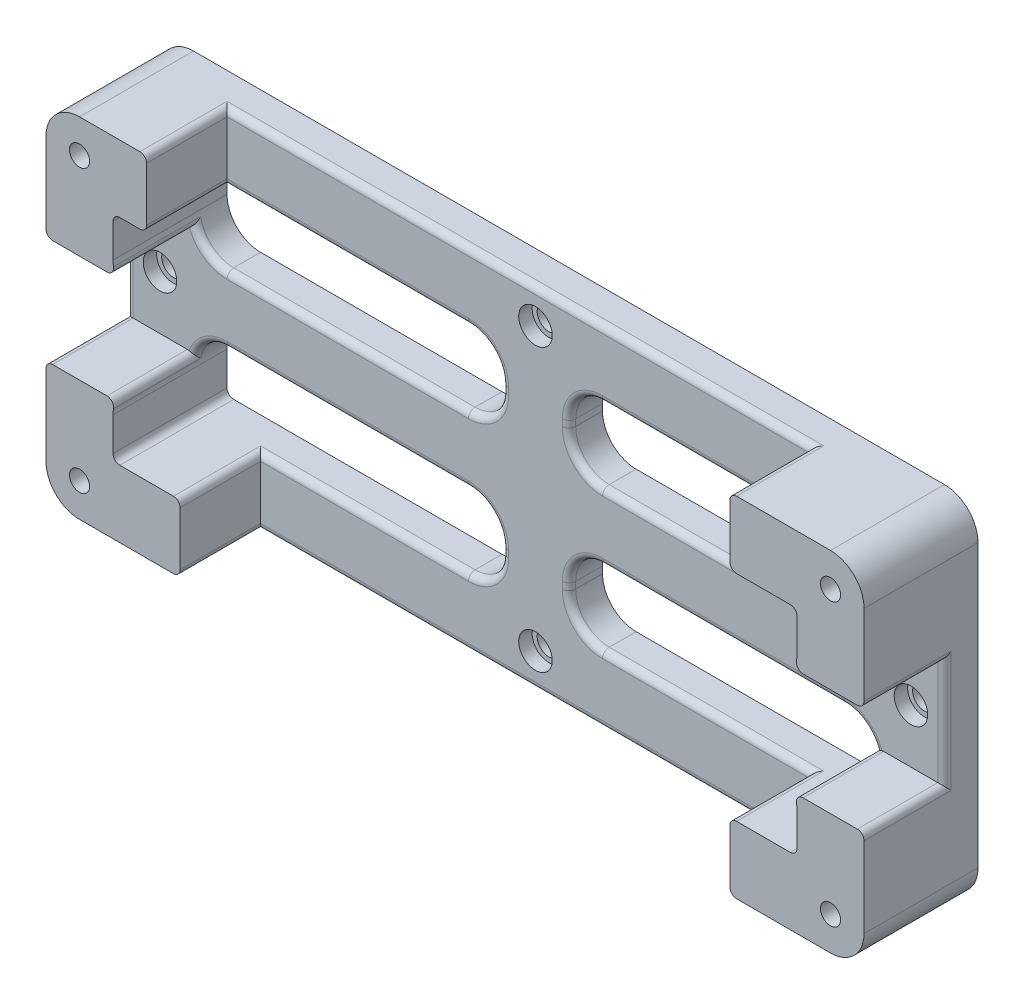
from build123d import *

# Parameters (mm, degrees)
SKETCH1_W           = 122
SKETCH1_H           = 52
SKETCH1_W_2         = 102
SKETCH1_H_2         = 32
BOSS_EXTRUDE1_DEPTH = 5
BOSS_EXTRUDE2_DEPTH = 5
BOSS_EXTRUDE3_DEPTH = 12
SKETCH4_R           = 1.5
CUT_EXTRUDE1_DEPTH  = 7
SKETCH5_R           = 1.75
CUT_EXTRUDE2_DEPTH  = 121.216471417
SKETCH6_R           = 2.5
CUT_EXTRUDE3_DEPTH  = 2
FILLET1_R           = 5
FILLET2_R           = 1


with BuildPart() as part:
    # Sketch1 → Boss-Extrude1 (new body)
    with BuildSketch(Plane.XY):
        with Locations((51, 16)):
            Rectangle(SKETCH1_W, SKETCH1_H)
        with Locations((51, 16)):
            Rectangle(SKETCH1_W_2, SKETCH1_H_2, mode=Mode.SUBTRACT)
    extrude(amount=BOSS_EXTRUDE1_DEPTH)

    # Sketch2 → Boss-Extrude2 (add)
    with BuildSketch(Plane.XY.offset(5)):
        Polygon((51, 32), (56, 32), (56, 21), (102, 21), (102, 16), (102, 11), (56, 11), (56, 0), (51, 0), (46, 0), (46, 11), (0, 11), (0, 16), (0, 21), (46, 21), (46, 32), align=None)
    extrude(amount=-BOSS_EXTRUDE2_DEPTH)

    # Sketch3 → Boss-Extrude3 (add)
    with BuildSketch(Plane.XY.offset(5)):
        Polygon((-10, 42), (5, 42), (5, 32), (0, 32), (0, 24), (-10, 24), align=None)
        Polygon((-10, -10), (10, -10), (10, 0), (0, 0), (0, 8), (-10, 8), align=None)
        Polygon((112, -10), (112, 8), (102, 8), (102, 0), (92, 0), (92, -10), align=None)
        Polygon((112, 42), (92, 42), (92, 32), (102, 32), (102, 24), (112, 24), align=None)
    extrude(amount=BOSS_EXTRUDE3_DEPTH)

    # Sketch4 → Cut-Extrude1 (cut)
    with BuildSketch(Plane.XY.offset(17)):
        with Locations((-5, 37)):
            Circle(SKETCH4_R)
        with Locations((107, 37)):
            Circle(SKETCH4_R)
        with Locations((107, -5)):
            Circle(SKETCH4_R)
        with Locations((-5, -5)):
            Circle(SKETCH4_R)
    extrude(amount=-CUT_EXTRUDE1_DEPTH, mode=Mode.SUBTRACT)

    # Sketch5 → Cut-Extrude2 (cut, through all)
    with BuildSketch(Plane.XY.offset(5)):
        with Locations((-5, 16)):
            Circle(SKETCH5_R)
        with Locations((51, 37)):
            Circle(SKETCH5_R)
        with Locations((107, 16)):
            Circle(SKETCH5_R)
        with Locations((51, -5)):
            Circle(SKETCH5_R)
    extrude(amount=-CUT_EXTRUDE2_DEPTH, mode=Mode.SUBTRACT)

    # Sketch6 → Cut-Extrude3 (cut)
    with BuildSketch(Plane.XY.offset(5)):
        with Locations((-5, 16)):
            Circle(SKETCH6_R)
        with Locations((51, 37)):
            Circle(SKETCH6_R)
        with Locations((51, -5)):
            Circle(SKETCH6_R)
        with Locations((107, 16)):
            Circle(SKETCH6_R)
    extrude(amount=-CUT_EXTRUDE3_DEPTH, mode=Mode.SUBTRACT)

    # Fillet1
    fillet1_edges = [part.edges().sort_by_distance(p)[0] for p in [
        (-10, 42, 8.5),
        (112, 42, 8.5),
        (112, -10, 8.5),
        (-10, -10, 8.5),
        (56, 11, 2.5),
        (56, 0, 2.5),
        (56, 21, 2.5),
        (102, 21, 2.5),
        (56, 32, 2.5),
        (102, 11, 2.5),
        (46, 0, 2.5),
        (46, 11, 2.5),
        (0, 11, 2.5),
        (0, 21, 2.5),
        (46, 32, 2.5),
        (46, 21, 2.5),
    ]]
    fillet(fillet1_edges, radius=FILLET1_R)

    # Fillet2
    # the kernel refuses this fillet: 1 mm, written as the material it adds along each edge
    with BuildSketch(Plane(origin=(0, 32, 0), x_dir=(0, -1, 0), z_dir=(0, 0, 1)), Plane(origin=(102, 0, 0), x_dir=(0, 1, 0), z_dir=(0, 0, 1)), Plane(origin=(102, 32, 0), x_dir=(-1, 0, 0), z_dir=(0, 0, 1))) as fillet2_piece_1:
        with BuildLine():
            CenterArc((FILLET2_R, FILLET2_R), FILLET2_R, 180, 90)
            Line((0, FILLET2_R), (0, 0))
            Line((0, 0), (FILLET2_R, 0))
        make_face()
    extrude(amount=17)
    with BuildSketch(Plane(origin=(0, 0, 17), x_dir=(1, 0, 0), z_dir=(0, 0, -1))) as fillet2_piece_2:
        with BuildLine():
            CenterArc((FILLET2_R, -FILLET2_R), FILLET2_R, 90, 90)
            Line((0, -FILLET2_R), (0, 0))
            Line((0, 0), (FILLET2_R, 0))
        make_face()
    extrude(amount=17)
    # the kernel refuses this fillet: 1 mm, written as the material it takes off along each edge
    with BuildSketch(Plane(origin=(112, 8, 5), x_dir=(-1, 0, 0), z_dir=(0, 1, 0)), Plane(origin=(-10, 24, 5), x_dir=(1, 0, 0), z_dir=(0, -1, 0))) as fillet2_2_piece_1:
        with BuildLine():
            CenterArc((FILLET2_R, -FILLET2_R), FILLET2_R, 90, 90)
            Line((0, -FILLET2_R), (0, 0))
            Line((0, 0), (FILLET2_R, 0))
        make_face()
    extrude(amount=16, mode=Mode.SUBTRACT)
    with BuildSketch(Plane(origin=(92, -10, 5), x_dir=(1, 0, 0), z_dir=(0, 0, 1)), Plane(origin=(92, 0, 5), x_dir=(0, -1, 0), z_dir=(0, 0, 1)), Plane(origin=(112, 24, 5), x_dir=(0, 1, 0), z_dir=(0, 0, 1)), Plane(origin=(92, 32, 5), x_dir=(1, 0, 0), z_dir=(0, 0, 1)), Plane(origin=(5, 42, 5), x_dir=(-1, 0, 0), z_dir=(0, 0, 1)), Plane(origin=(-10, 8, 5), x_dir=(0, -1, 0), z_dir=(0, 0, 1))) as fillet2_2_piece_2:
        with BuildLine():
            CenterArc((FILLET2_R, FILLET2_R), FILLET2_R, 180, 90)
            Line((0, FILLET2_R), (0, 0))
            Line((0, 0), (FILLET2_R, 0))
        make_face()
    extrude(amount=14.5, mode=Mode.SUBTRACT)
    with BuildSketch(Plane(origin=(112, 8, 5), x_dir=(0, -1, 0), z_dir=(0, 0, 1)), Plane(origin=(92, 42, 5), x_dir=(1, 0, 0), z_dir=(0, 0, 1)), Plane(origin=(-10, 24, 5), x_dir=(0, 1, 0), z_dir=(0, 0, 1)), Plane(origin=(5, 32, 5), x_dir=(-1, 0, 0), z_dir=(0, 0, 1)), Plane(origin=(10, -10, 5), x_dir=(-1, 0, 0), z_dir=(0, 0, 1)), Plane(origin=(10, 0, 5), x_dir=(0, -1, 0), z_dir=(0, 0, 1))) as fillet2_2_piece_3:
        with BuildLine():
            CenterArc((FILLET2_R, -FILLET2_R), FILLET2_R, 90, 90)
            Line((0, -FILLET2_R), (0, 0))
            Line((0, 0), (FILLET2_R, 0))
        make_face()
    extrude(amount=14.5, mode=Mode.SUBTRACT)
    with BuildSketch(Plane(origin=(92, 42, 5), x_dir=(0, -1, 0), z_dir=(-1, 0, 0))) as fillet2_2_piece_4:
        with BuildLine():
            CenterArc((FILLET2_R, -FILLET2_R), FILLET2_R, 90, 90)
            Line((0, -FILLET2_R), (0, 0))
            Line((0, 0), (FILLET2_R, 0))
        make_face()
    extrude(amount=87, mode=Mode.SUBTRACT)
    with BuildSketch(Plane(origin=(92, 32, 5), x_dir=(0, 1, 0), z_dir=(-1, 0, 0)), Plane(origin=(61, 0, 5), x_dir=(0, -1, 0), z_dir=(1, 0, 0)), Plane(origin=(10, 0, 5), x_dir=(0, -1, 0), z_dir=(1, 0, 0))) as fillet2_2_piece_5:
        with BuildLine():
            CenterArc((FILLET2_R, FILLET2_R), FILLET2_R, 180, 90)
            Line((0, FILLET2_R), (0, 0))
            Line((0, 0), (FILLET2_R, 0))
        make_face()
    extrude(amount=31, mode=Mode.SUBTRACT)
    with BuildSketch(Plane(origin=(56, 6, 5), x_dir=(-1, 0, 0), z_dir=(0, -1, 0)), Plane(origin=(56, 27, 5), x_dir=(-1, 0, 0), z_dir=(0, -1, 0)), Plane(origin=(46, 5, 5), x_dir=(1, 0, 0), z_dir=(0, 1, 0)), Plane(origin=(46, 26, 5), x_dir=(1, 0, 0), z_dir=(0, 1, 0))) as fillet2_2_piece_6:
        with BuildLine():
            CenterArc((FILLET2_R, FILLET2_R), FILLET2_R, 180, 90)
            Line((0, FILLET2_R), (0, 0))
            Line((0, 0), (FILLET2_R, 0))
        make_face()
    extrude(amount=1, mode=Mode.SUBTRACT)
    with BuildSketch(Plane(origin=(97, 11, 5), x_dir=(0, 1, 0), z_dir=(-1, 0, 0)), Plane(origin=(61, 21, 5), x_dir=(0, -1, 0), z_dir=(1, 0, 0)), Plane(origin=(41, 11, 5), x_dir=(0, 1, 0), z_dir=(-1, 0, 0)), Plane(origin=(5, 21, 5), x_dir=(0, -1, 0), z_dir=(1, 0, 0)), Plane(origin=(41, 32, 5), x_dir=(0, 1, 0), z_dir=(-1, 0, 0))) as fillet2_2_piece_7:
        with BuildLine():
            CenterArc((FILLET2_R, FILLET2_R), FILLET2_R, 180, 90)
            Line((0, FILLET2_R), (0, 0))
            Line((0, 0), (FILLET2_R, 0))
        make_face()
    extrude(amount=36, mode=Mode.SUBTRACT)
    with BuildSketch(Plane(origin=(61, 6, 5), x_dir=(-1, 0, 0), z_dir=(0, -1, 0))) as fillet2_2_piece_8:
        with BuildLine():
            CenterArc((5 + FILLET2_R, FILLET2_R), FILLET2_R, 180, 90)
            Line((5, FILLET2_R), (5, 0))
            Line((5, 0), (5 + FILLET2_R, 0))
        make_face()
    revolve(axis=Axis((61, 6, 5), (0, 0, -1)), revolution_arc=90, mode=Mode.SUBTRACT)
    with BuildSketch(Plane(origin=(61, 5, 5), x_dir=(0, -1, 0), z_dir=(1, 0, 0))) as fillet2_2_piece_9:
        with BuildLine():
            CenterArc((5 + FILLET2_R, FILLET2_R), FILLET2_R, 180, 90)
            Line((5, FILLET2_R), (5, 0))
            Line((5, 0), (5 + FILLET2_R, 0))
        make_face()
    revolve(axis=Axis((61, 5, 5), (0, 0, -1)), revolution_arc=90, mode=Mode.SUBTRACT)
    with BuildSketch(Plane(origin=(61, 26, 5), x_dir=(0, -1, 0), z_dir=(1, 0, 0))) as fillet2_2_piece_10:
        with BuildLine():
            CenterArc((5 + FILLET2_R, FILLET2_R), FILLET2_R, 180, 90)
            Line((5, FILLET2_R), (5, 0))
            Line((5, 0), (5 + FILLET2_R, 0))
        make_face()
    revolve(axis=Axis((61, 26, 5), (0, 0, -1)), revolution_arc=90, mode=Mode.SUBTRACT)
    with BuildSketch(Plane(origin=(101.582575695, 24, 20.33376022), x_dir=(0.28545625982941963, 0.9583917381343596, 0), z_dir=(0, 0, -1)), Plane(origin=(101.582575695, 8, 5), x_dir=(0.2854562598294208, -0.9583917381343592, 0), z_dir=(0, 0, 1))) as fillet2_2_piece_11:
        with BuildLine():
            CenterArc((1.339048828, 0.992563041), FILLET2_R, 163.413876647, 99.594068227)
            Line((0.380657089, 1.278019301), (0, 0))
            ThreePointArc((0, 0), (0.608658558, 0.037184795), (1.217317116, 0))
        make_face()
    extrude(amount=15.33376022, mode=Mode.SUBTRACT)
    with BuildSketch(Plane(origin=(97, 26, 5), x_dir=(0.9960782469793129, 0.08847669690160782, 0), z_dir=(-0.08847669690160782, 0.9960782469793129, 0))) as fillet2_2_piece_12_section:
        with BuildLine():
            CenterArc((5 + FILLET2_R, FILLET2_R), FILLET2_R, 180, 90)
            Line((5, FILLET2_R), (5, 0))
            Line((5, 0), (5 + FILLET2_R, 0))
        make_face()
    fillet2_2_piece_12 = revolve(axis=Axis((97, 26, 5), (0, 0, -1)), revolution_arc=95.075978632, mode=Mode.PRIVATE)
    fillet2_2_piece_12 = split(fillet2_2_piece_12, bisect_by=Plane(origin=(100.051108418, 24, 4.715325201), z_dir=(0, -1, 0)), keep=Keep.TOP, mode=Mode.PRIVATE)
    add(fillet2_2_piece_12, mode=Mode.SUBTRACT)
    with BuildSketch(Plane(origin=(61, 27, 5), x_dir=(-1, 0, 0), z_dir=(0, -1, 0))) as fillet2_2_piece_13:
        with BuildLine():
            CenterArc((5 + FILLET2_R, FILLET2_R), FILLET2_R, 180, 90)
            Line((5, FILLET2_R), (5, 0))
            Line((5, 0), (5 + FILLET2_R, 0))
        make_face()
    revolve(axis=Axis((61, 27, 5), (0, 0, -1)), revolution_arc=90, mode=Mode.SUBTRACT)
    with BuildSketch(Plane(origin=(97, 6, 5), x_dir=(0, 1, 0), z_dir=(-1, 0, 0))) as fillet2_2_piece_14_section:
        with BuildLine():
            CenterArc((5 + FILLET2_R, FILLET2_R), FILLET2_R, 180, 90)
            Line((5, FILLET2_R), (5, 0))
            Line((5, 0), (5 + FILLET2_R, 0))
        make_face()
    fillet2_2_piece_14 = revolve(axis=Axis((97, 6, 5), (0, 0, -1)), revolution_arc=95.075978632, mode=Mode.PRIVATE)
    fillet2_2_piece_14 = split(fillet2_2_piece_14, bisect_by=Plane(origin=(100.051108415, 8, 4.715325206), z_dir=(0, 1, 0)), keep=Keep.TOP, mode=Mode.PRIVATE)
    add(fillet2_2_piece_14, mode=Mode.SUBTRACT)
    with BuildSketch(Plane(origin=(41, 5, 5), x_dir=(0, -1, 0), z_dir=(-1, 0, 0))) as fillet2_2_piece_15:
        with BuildLine():
            CenterArc((5 + FILLET2_R, -FILLET2_R), FILLET2_R, 90, 90)
            Line((5, -FILLET2_R), (5, 0))
            Line((5, 0), (5 + FILLET2_R, 0))
        make_face()
    revolve(axis=Axis((41, 5, 5), (0, 0, 1)), revolution_arc=90, mode=Mode.SUBTRACT)
    with BuildSketch(Plane(origin=(41, 6, 5), x_dir=(1, 0, 0), z_dir=(0, -1, 0))) as fillet2_2_piece_16:
        with BuildLine():
            CenterArc((5 + FILLET2_R, -FILLET2_R), FILLET2_R, 90, 90)
            Line((5, -FILLET2_R), (5, 0))
            Line((5, 0), (5 + FILLET2_R, 0))
        make_face()
    revolve(axis=Axis((41, 6, 5), (0, 0, 1)), revolution_arc=90, mode=Mode.SUBTRACT)
    with BuildSketch(Plane(origin=(0.417424305, 8, 20.33376022), x_dir=(-1, 0, 0), z_dir=(0, 0, -1))) as fillet2_2_piece_17:
        with BuildLine():
            CenterArc((1.333504088, -1), FILLET2_R, 90, 99.594068227)
            ThreePointArc((0.347490791, -1.166666667), (0.209382996, -0.572718701), (0, 0))
            Line((0, 0), (1.333504088, 0))
        make_face()
    extrude(amount=15.33376022, mode=Mode.SUBTRACT)
    with BuildSketch(Plane(origin=(5, 6, 5), x_dir=(-0.9960782469793135, -0.08847669690160202, 0), z_dir=(0.08847669690160202, -0.9960782469793135, 0))) as fillet2_2_piece_18_section:
        with BuildLine():
            CenterArc((5 + FILLET2_R, FILLET2_R), FILLET2_R, 180, 90)
            Line((5, FILLET2_R), (5, 0))
            Line((5, 0), (5 + FILLET2_R, 0))
        make_face()
    fillet2_2_piece_18 = revolve(axis=Axis((5, 6, 5), (0, 0, -1)), revolution_arc=95.075978632, mode=Mode.PRIVATE)
    fillet2_2_piece_18 = split(fillet2_2_piece_18, bisect_by=Plane(origin=(1.948891582, 8, 4.715325201), z_dir=(0, 1, 0)), keep=Keep.TOP, mode=Mode.PRIVATE)
    add(fillet2_2_piece_18, mode=Mode.SUBTRACT)
    with BuildSketch(Plane(origin=(5, 26, 5), x_dir=(-0.9960782469793129, 0.08847669690160771, 0), z_dir=(0.08847669690160771, 0.9960782469793129, 0))) as fillet2_2_piece_19_section:
        with BuildLine():
            CenterArc((5 + FILLET2_R, -FILLET2_R), FILLET2_R, 90, 90)
            Line((5, -FILLET2_R), (5, 0))
            Line((5, 0), (5 + FILLET2_R, 0))
        make_face()
    fillet2_2_piece_19 = revolve(axis=Axis((5, 26, 5), (0, 0, 1)), revolution_arc=95.075978632, mode=Mode.PRIVATE)
    fillet2_2_piece_19 = split(fillet2_2_piece_19, bisect_by=Plane(origin=(1.948891582, 24, 4.715325201), z_dir=(0, -1, 0)), keep=Keep.TOP, mode=Mode.PRIVATE)
    add(fillet2_2_piece_19, mode=Mode.SUBTRACT)
    with BuildSketch(Plane(origin=(0.417424305, 24, 20.33376022), x_dir=(-0.28545625982941775, 0.9583917381343602, 0), z_dir=(0, 0, -1))) as fillet2_2_piece_20:
        with BuildLine():
            CenterArc((1.339048828, -0.992563041), FILLET2_R, 96.992055126, 99.594068227)
            Line((0.380657089, -1.278019301), (0, 0))
            ThreePointArc((0, 0), (0.608658558, -0.037184795), (1.217317116, 0))
        make_face()
    extrude(amount=15.33376022, mode=Mode.SUBTRACT)
    with BuildSketch(Plane(origin=(41, 27, 5), x_dir=(1, 0, 0), z_dir=(0, -1, 0))) as fillet2_2_piece_21:
        with BuildLine():
            CenterArc((5 + FILLET2_R, -FILLET2_R), FILLET2_R, 90, 90)
            Line((5, -FILLET2_R), (5, 0))
            Line((5, 0), (5 + FILLET2_R, 0))
        make_face()
    revolve(axis=Axis((41, 27, 5), (0, 0, 1)), revolution_arc=90, mode=Mode.SUBTRACT)
    with BuildSketch(Plane(origin=(41, 26, 5), x_dir=(0, -1, 0), z_dir=(-1, 0, 0))) as fillet2_2_piece_22:
        with BuildLine():
            CenterArc((5 + FILLET2_R, -FILLET2_R), FILLET2_R, 90, 90)
            Line((5, -FILLET2_R), (5, 0))
            Line((5, 0), (5 + FILLET2_R, 0))
        make_face()
    revolve(axis=Axis((41, 26, 5), (0, 0, 1)), revolution_arc=90, mode=Mode.SUBTRACT)
    with BuildSketch(Plane(origin=(10, -10, 5), x_dir=(0, 0, -1), z_dir=(1, 0, 0))) as fillet2_2_piece_23:
        with BuildLine():
            CenterArc((FILLET2_R, FILLET2_R), FILLET2_R, 180, 90)
            Line((0, FILLET2_R), (0, 0))
            Line((0, 0), (FILLET2_R, 0))
        make_face()
    extrude(amount=82, mode=Mode.SUBTRACT)
    with BuildSketch(Plane(origin=(112, 5.5, 5), x_dir=(-1, 0, 0), z_dir=(0, 1, 0))) as fillet2_2_piece_24a_section:
        with BuildLine():
            CenterArc((FILLET2_R, -FILLET2_R), FILLET2_R, 90, 90)
            Line((0, -FILLET2_R), (0, 0))
            Line((0, 0), (FILLET2_R, 0))
        make_face()
    fillet2_2_piece_24a = extrude(amount=18.5, mode=Mode.PRIVATE)
    fillet2_2_piece_24a = split(fillet2_2_piece_24a, bisect_by=Plane(origin=(111.773604886, 8, 4.773604886), z_dir=(0, -1, 0)), keep=Keep.TOP, mode=Mode.PRIVATE)
    with BuildSketch(Plane(origin=(112, 8, 2.5), x_dir=(0, -1, 0), z_dir=(0, 0, 1))) as fillet2_2_piece_24b_section:
        with BuildLine():
            CenterArc((FILLET2_R, -FILLET2_R), FILLET2_R, 90, 90)
            Line((0, -FILLET2_R), (0, 0))
            Line((0, 0), (FILLET2_R, 0))
        make_face()
    fillet2_2_piece_24b = extrude(amount=17, mode=Mode.PRIVATE)
    fillet2_2_piece_24b = split(fillet2_2_piece_24b, bisect_by=Plane(origin=(111.773604886, 7.773604886, 5), z_dir=(0, 0, -1)), keep=Keep.TOP, mode=Mode.PRIVATE)
    fillet2_2_piece_24 = fillet2_2_piece_24a & fillet2_2_piece_24b
    add(fillet2_2_piece_24, mode=Mode.SUBTRACT)
    with BuildSketch(Plane(origin=(112, 8, 5), x_dir=(-1, 0, 0), z_dir=(0, 1, 0))) as fillet2_2_piece_25a_section:
        with BuildLine():
            CenterArc((FILLET2_R, -FILLET2_R), FILLET2_R, 90, 90)
            Line((0, -FILLET2_R), (0, 0))
            Line((0, 0), (FILLET2_R, 0))
        make_face()
    fillet2_2_piece_25a = extrude(amount=18.5, mode=Mode.PRIVATE)
    fillet2_2_piece_25a = split(fillet2_2_piece_25a, bisect_by=Plane(origin=(111.773604886, 24, 4.773604886), z_dir=(0, 1, 0)), keep=Keep.TOP, mode=Mode.PRIVATE)
    with BuildSketch(Plane(origin=(112, 24, 2.5), x_dir=(0, 1, 0), z_dir=(0, 0, 1))) as fillet2_2_piece_25b_section:
        with BuildLine():
            CenterArc((FILLET2_R, FILLET2_R), FILLET2_R, 180, 90)
            Line((0, FILLET2_R), (0, 0))
            Line((0, 0), (FILLET2_R, 0))
        make_face()
    fillet2_2_piece_25b = extrude(amount=17, mode=Mode.PRIVATE)
    fillet2_2_piece_25b = split(fillet2_2_piece_25b, bisect_by=Plane(origin=(111.773604886, 24.226395114, 5), z_dir=(0, 0, -1)), keep=Keep.TOP, mode=Mode.PRIVATE)
    fillet2_2_piece_25 = fillet2_2_piece_25a & fillet2_2_piece_25b
    add(fillet2_2_piece_25, mode=Mode.SUBTRACT)
    with BuildSketch(Plane(origin=(10, -10, 5), x_dir=(0, 0, -1), z_dir=(1, 0, 0))) as fillet2_2_piece_26a_section:
        with BuildLine():
            CenterArc((FILLET2_R, FILLET2_R), FILLET2_R, 180, 90)
            Line((0, FILLET2_R), (0, 0))
            Line((0, 0), (FILLET2_R, 0))
        make_face()
    fillet2_2_piece_26a = extrude(amount=84.5, mode=Mode.PRIVATE)
    fillet2_2_piece_26a = split(fillet2_2_piece_26a, bisect_by=Plane(origin=(92, -9.773604886, 4.773604886), z_dir=(1, 0, 0)), keep=Keep.TOP, mode=Mode.PRIVATE)
    with BuildSketch(Plane(origin=(92, -10, 2.5), x_dir=(1, 0, 0), z_dir=(0, 0, 1))) as fillet2_2_piece_26b_section:
        with BuildLine():
            CenterArc((FILLET2_R, FILLET2_R), FILLET2_R, 180, 90)
            Line((0, FILLET2_R), (0, 0))
            Line((0, 0), (FILLET2_R, 0))
        make_face()
    fillet2_2_piece_26b = extrude(amount=17, mode=Mode.PRIVATE)
    fillet2_2_piece_26b = split(fillet2_2_piece_26b, bisect_by=Plane(origin=(92.226395114, -9.773604886, 5), z_dir=(0, 0, -1)), keep=Keep.TOP, mode=Mode.PRIVATE)
    fillet2_2_piece_26 = fillet2_2_piece_26a & fillet2_2_piece_26b
    add(fillet2_2_piece_26, mode=Mode.SUBTRACT)
    with BuildSketch(Plane(origin=(61, 0, 5), x_dir=(0, -1, 0), z_dir=(1, 0, 0))) as fillet2_2_piece_27a_section:
        with BuildLine():
            CenterArc((FILLET2_R, FILLET2_R), FILLET2_R, 180, 90)
            Line((0, FILLET2_R), (0, 0))
            Line((0, 0), (FILLET2_R, 0))
        make_face()
    fillet2_2_piece_27a = extrude(amount=33.5, mode=Mode.PRIVATE)
    fillet2_2_piece_27a = split(fillet2_2_piece_27a, bisect_by=Plane(origin=(92, -0.226395114, 4.773604886), z_dir=(1, 0, 0)), keep=Keep.TOP, mode=Mode.PRIVATE)
    with BuildSketch(Plane(origin=(92, 0, 2.5), x_dir=(0, -1, 0), z_dir=(0, 0, 1))) as fillet2_2_piece_27b_section:
        with BuildLine():
            CenterArc((FILLET2_R, FILLET2_R), FILLET2_R, 180, 90)
            Line((0, FILLET2_R), (0, 0))
            Line((0, 0), (FILLET2_R, 0))
        make_face()
    fillet2_2_piece_27b = extrude(amount=17, mode=Mode.PRIVATE)
    fillet2_2_piece_27b = split(fillet2_2_piece_27b, bisect_by=Plane(origin=(92.226395114, -0.226395114, 5), z_dir=(0, 0, -1)), keep=Keep.TOP, mode=Mode.PRIVATE)
    fillet2_2_piece_27 = fillet2_2_piece_27a & fillet2_2_piece_27b
    add(fillet2_2_piece_27, mode=Mode.SUBTRACT)
    with BuildSketch(Plane(origin=(94.5, 42, 5), x_dir=(0, -1, 0), z_dir=(-1, 0, 0))) as fillet2_2_piece_28a_section:
        with BuildLine():
            CenterArc((FILLET2_R, -FILLET2_R), FILLET2_R, 90, 90)
            Line((0, -FILLET2_R), (0, 0))
            Line((0, 0), (FILLET2_R, 0))
        make_face()
    fillet2_2_piece_28a = extrude(amount=89.5, mode=Mode.PRIVATE)
    fillet2_2_piece_28a = split(fillet2_2_piece_28a, bisect_by=Plane(origin=(92, 41.773604886, 4.773604886), z_dir=(1, 0, 0)), keep=Keep.TOP, mode=Mode.PRIVATE)
    with BuildSketch(Plane(origin=(92, 42, 2.5), x_dir=(1, 0, 0), z_dir=(0, 0, 1))) as fillet2_2_piece_28b_section:
        with BuildLine():
            CenterArc((FILLET2_R, -FILLET2_R), FILLET2_R, 90, 90)
            Line((0, -FILLET2_R), (0, 0))
            Line((0, 0), (FILLET2_R, 0))
        make_face()
    fillet2_2_piece_28b = extrude(amount=17, mode=Mode.PRIVATE)
    fillet2_2_piece_28b = split(fillet2_2_piece_28b, bisect_by=Plane(origin=(92.226395114, 41.773604886, 5), z_dir=(0, 0, -1)), keep=Keep.TOP, mode=Mode.PRIVATE)
    fillet2_2_piece_28 = fillet2_2_piece_28a & fillet2_2_piece_28b
    add(fillet2_2_piece_28, mode=Mode.SUBTRACT)
    with BuildSketch(Plane(origin=(92, 42, 5), x_dir=(0, -1, 0), z_dir=(-1, 0, 0))) as fillet2_2_piece_29a_section:
        with BuildLine():
            CenterArc((FILLET2_R, -FILLET2_R), FILLET2_R, 90, 90)
            Line((0, -FILLET2_R), (0, 0))
            Line((0, 0), (FILLET2_R, 0))
        make_face()
    fillet2_2_piece_29a = extrude(amount=89.5, mode=Mode.PRIVATE)
    fillet2_2_piece_29a = split(fillet2_2_piece_29a, bisect_by=Plane(origin=(5, 41.773604886, 4.773604886), z_dir=(-1, 0, 0)), keep=Keep.TOP, mode=Mode.PRIVATE)
    with BuildSketch(Plane(origin=(5, 42, 2.5), x_dir=(-1, 0, 0), z_dir=(0, 0, 1))) as fillet2_2_piece_29b_section:
        with BuildLine():
            CenterArc((FILLET2_R, FILLET2_R), FILLET2_R, 180, 90)
            Line((0, FILLET2_R), (0, 0))
            Line((0, 0), (FILLET2_R, 0))
        make_face()
    fillet2_2_piece_29b = extrude(amount=17, mode=Mode.PRIVATE)
    fillet2_2_piece_29b = split(fillet2_2_piece_29b, bisect_by=Plane(origin=(4.773604886, 41.773604886, 5), z_dir=(0, 0, -1)), keep=Keep.TOP, mode=Mode.PRIVATE)
    fillet2_2_piece_29 = fillet2_2_piece_29a & fillet2_2_piece_29b
    add(fillet2_2_piece_29, mode=Mode.SUBTRACT)
    with BuildSketch(Plane(origin=(94.5, 32, 5), x_dir=(0, 1, 0), z_dir=(-1, 0, 0))) as fillet2_2_piece_30a_section:
        with BuildLine():
            CenterArc((FILLET2_R, FILLET2_R), FILLET2_R, 180, 90)
            Line((0, FILLET2_R), (0, 0))
            Line((0, 0), (FILLET2_R, 0))
        make_face()
    fillet2_2_piece_30a = extrude(amount=33.5, mode=Mode.PRIVATE)
    fillet2_2_piece_30a = split(fillet2_2_piece_30a, bisect_by=Plane(origin=(92, 32.226395114, 4.773604886), z_dir=(1, 0, 0)), keep=Keep.TOP, mode=Mode.PRIVATE)
    with BuildSketch(Plane(origin=(92, 32, 2.5), x_dir=(1, 0, 0), z_dir=(0, 0, 1))) as fillet2_2_piece_30b_section:
        with BuildLine():
            CenterArc((FILLET2_R, FILLET2_R), FILLET2_R, 180, 90)
            Line((0, FILLET2_R), (0, 0))
            Line((0, 0), (FILLET2_R, 0))
        make_face()
    fillet2_2_piece_30b = extrude(amount=17, mode=Mode.PRIVATE)
    fillet2_2_piece_30b = split(fillet2_2_piece_30b, bisect_by=Plane(origin=(92.226395114, 32.226395114, 5), z_dir=(0, 0, -1)), keep=Keep.TOP, mode=Mode.PRIVATE)
    fillet2_2_piece_30 = fillet2_2_piece_30a & fillet2_2_piece_30b
    add(fillet2_2_piece_30, mode=Mode.SUBTRACT)
    with BuildSketch(Plane(origin=(41, 32, 5), x_dir=(0, 1, 0), z_dir=(-1, 0, 0))) as fillet2_2_piece_31a_section:
        with BuildLine():
            CenterArc((FILLET2_R, FILLET2_R), FILLET2_R, 180, 90)
            Line((0, FILLET2_R), (0, 0))
            Line((0, 0), (FILLET2_R, 0))
        make_face()
    fillet2_2_piece_31a = extrude(amount=38.5, mode=Mode.PRIVATE)
    fillet2_2_piece_31a = split(fillet2_2_piece_31a, bisect_by=Plane(origin=(5, 32.226395114, 4.773604886), z_dir=(-1, 0, 0)), keep=Keep.TOP, mode=Mode.PRIVATE)
    with BuildSketch(Plane(origin=(5, 32, 2.5), x_dir=(-1, 0, 0), z_dir=(0, 0, 1))) as fillet2_2_piece_31b_section:
        with BuildLine():
            CenterArc((FILLET2_R, -FILLET2_R), FILLET2_R, 90, 90)
            Line((0, -FILLET2_R), (0, 0))
            Line((0, 0), (FILLET2_R, 0))
        make_face()
    fillet2_2_piece_31b = extrude(amount=17, mode=Mode.PRIVATE)
    fillet2_2_piece_31b = split(fillet2_2_piece_31b, bisect_by=Plane(origin=(4.773604886, 32.226395114, 5), z_dir=(0, 0, -1)), keep=Keep.TOP, mode=Mode.PRIVATE)
    fillet2_2_piece_31 = fillet2_2_piece_31a & fillet2_2_piece_31b
    add(fillet2_2_piece_31, mode=Mode.SUBTRACT)
    with BuildSketch(Plane(origin=(97, 26, 5), x_dir=(0.9960782469793129, 0.08847669690160782, 0), z_dir=(-0.08847669690160782, 0.9960782469793129, 0))) as fillet2_2_piece_32a_section:
        with BuildLine():
            CenterArc((5 + FILLET2_R, FILLET2_R), FILLET2_R, 180, 90)
            Line((5, FILLET2_R), (5, 0))
            Line((5, 0), (5 + FILLET2_R, 0))
        make_face()
    fillet2_2_piece_32a = revolve(axis=Axis((97, 26, 5), (0, 0, -1)), revolution_arc=95.075978632, mode=Mode.PRIVATE)
    fillet2_2_piece_32a = split(fillet2_2_piece_32a, bisect_by=Plane(origin=(102.117412409, 24, 4.774344712), z_dir=(0, 1, 0)), keep=Keep.TOP, mode=Mode.PRIVATE)
    with BuildSketch(Plane(origin=(101.582575695, 24, 20.33376022), x_dir=(0.28545625982941963, 0.9583917381343596, 0), z_dir=(0, 0, -1))) as fillet2_2_piece_32b_section:
        with BuildLine():
            CenterArc((1.339048828, 0.992563041), FILLET2_R, 163.413876647, 99.594068227)
            Line((0.380657089, 1.278019301), (0, 0))
            ThreePointArc((0, 0), (0.608658558, 0.037184795), (1.217317116, 0))
        make_face()
    fillet2_2_piece_32b = extrude(amount=18.667520441, mode=Mode.PRIVATE)
    fillet2_2_piece_32b = split(fillet2_2_piece_32b, bisect_by=Plane(origin=(102.003252364, 24.270753298, 5), z_dir=(0, 0, -1)), keep=Keep.TOP, mode=Mode.PRIVATE)
    fillet2_2_piece_32 = fillet2_2_piece_32a & fillet2_2_piece_32b
    add(fillet2_2_piece_32, mode=Mode.SUBTRACT)
    with BuildSketch(Plane(origin=(97, 6, 5), x_dir=(0, 1, 0), z_dir=(-1, 0, 0))) as fillet2_2_piece_33a_section:
        with BuildLine():
            CenterArc((5 + FILLET2_R, FILLET2_R), FILLET2_R, 180, 90)
            Line((5, FILLET2_R), (5, 0))
            Line((5, 0), (5 + FILLET2_R, 0))
        make_face()
    fillet2_2_piece_33a = revolve(axis=Axis((97, 6, 5), (0, 0, -1)), revolution_arc=95.075978632, mode=Mode.PRIVATE)
    fillet2_2_piece_33a = split(fillet2_2_piece_33a, bisect_by=Plane(origin=(102.117412014, 8, 4.774344614), z_dir=(0, -1, 0)), keep=Keep.TOP, mode=Mode.PRIVATE)
    with BuildSketch(Plane(origin=(101.582575695, 8, 1.66623978), x_dir=(0.2854562598294208, -0.9583917381343592, 0), z_dir=(0, 0, 1))) as fillet2_2_piece_33b_section:
        with BuildLine():
            CenterArc((1.339048828, 0.992563041), FILLET2_R, 163.413876647, 99.594068227)
            Line((0.380657089, 1.278019301), (0, 0))
            ThreePointArc((0, 0), (0.608658558, 0.037184795), (1.217317116, 0))
        make_face()
    fillet2_2_piece_33b = extrude(amount=18.667520441, mode=Mode.PRIVATE)
    fillet2_2_piece_33b = split(fillet2_2_piece_33b, bisect_by=Plane(origin=(102.003252364, 7.729246702, 5), z_dir=(0, 0, -1)), keep=Keep.TOP, mode=Mode.PRIVATE)
    fillet2_2_piece_33 = fillet2_2_piece_33a & fillet2_2_piece_33b
    add(fillet2_2_piece_33, mode=Mode.SUBTRACT)
    with BuildSketch(Plane(origin=(5, 6, 5), x_dir=(-0.9960782469793135, -0.08847669690160202, 0), z_dir=(0.08847669690160202, -0.9960782469793135, 0))) as fillet2_2_piece_34a_section:
        with BuildLine():
            CenterArc((5 + FILLET2_R, FILLET2_R), FILLET2_R, 180, 90)
            Line((5, FILLET2_R), (5, 0))
            Line((5, 0), (5 + FILLET2_R, 0))
        make_face()
    fillet2_2_piece_34a = revolve(axis=Axis((5, 6, 5), (0, 0, -1)), revolution_arc=95.075978632, mode=Mode.PRIVATE)
    fillet2_2_piece_34a = split(fillet2_2_piece_34a, bisect_by=Plane(origin=(-0.117412409, 8, 4.774344712), z_dir=(0, -1, 0)), keep=Keep.TOP, mode=Mode.PRIVATE)
    with BuildSketch(Plane(origin=(0.417424305, 8, 20.33376022), x_dir=(-1, 0, 0), z_dir=(0, 0, -1))) as fillet2_2_piece_34b_section:
        with BuildLine():
            CenterArc((1.333504088, -1), FILLET2_R, 90, 99.594068227)
            ThreePointArc((0.347490791, -1.166666667), (0.209382996, -0.572718701), (0, 0))
            Line((0, 0), (1.333504088, 0))
        make_face()
    fillet2_2_piece_34b = extrude(amount=18.667520441, mode=Mode.PRIVATE)
    fillet2_2_piece_34b = split(fillet2_2_piece_34b, bisect_by=Plane(origin=(-0.003252364, 7.729246702, 5), z_dir=(0, 0, -1)), keep=Keep.TOP, mode=Mode.PRIVATE)
    fillet2_2_piece_34 = fillet2_2_piece_34a & fillet2_2_piece_34b
    add(fillet2_2_piece_34, mode=Mode.SUBTRACT)
    with BuildSketch(Plane(origin=(5, 26, 5), x_dir=(-0.9960782469793129, 0.08847669690160771, 0), z_dir=(0.08847669690160771, 0.9960782469793129, 0))) as fillet2_2_piece_35a_section:
        with BuildLine():
            CenterArc((5 + FILLET2_R, -FILLET2_R), FILLET2_R, 90, 90)
            Line((5, -FILLET2_R), (5, 0))
            Line((5, 0), (5 + FILLET2_R, 0))
        make_face()
    fillet2_2_piece_35a = revolve(axis=Axis((5, 26, 5), (0, 0, 1)), revolution_arc=95.075978632, mode=Mode.PRIVATE)
    fillet2_2_piece_35a = split(fillet2_2_piece_35a, bisect_by=Plane(origin=(-0.117412409, 24, 4.774344712), z_dir=(0, 1, 0)), keep=Keep.TOP, mode=Mode.PRIVATE)
    with BuildSketch(Plane(origin=(0.417424305, 24, 20.33376022), x_dir=(-0.28545625982941775, 0.9583917381343602, 0), z_dir=(0, 0, -1))) as fillet2_2_piece_35b_section:
        with BuildLine():
            CenterArc((1.339048828, -0.992563041), FILLET2_R, 96.992055126, 99.594068227)
            Line((0.380657089, -1.278019301), (0, 0))
            ThreePointArc((0, 0), (0.608658558, -0.037184795), (1.217317116, 0))
        make_face()
    fillet2_2_piece_35b = extrude(amount=18.667520441, mode=Mode.PRIVATE)
    fillet2_2_piece_35b = split(fillet2_2_piece_35b, bisect_by=Plane(origin=(-0.003252364, 24.270753298, 5), z_dir=(0, 0, -1)), keep=Keep.TOP, mode=Mode.PRIVATE)
    fillet2_2_piece_35 = fillet2_2_piece_35a & fillet2_2_piece_35b
    add(fillet2_2_piece_35, mode=Mode.SUBTRACT)
    with BuildSketch(Plane(origin=(-10, 26.5, 5), x_dir=(1, 0, 0), z_dir=(0, -1, 0))) as fillet2_2_piece_36a_section:
        with BuildLine():
            CenterArc((FILLET2_R, -FILLET2_R), FILLET2_R, 90, 90)
            Line((0, -FILLET2_R), (0, 0))
            Line((0, 0), (FILLET2_R, 0))
        make_face()
    fillet2_2_piece_36a = extrude(amount=18.5, mode=Mode.PRIVATE)
    fillet2_2_piece_36a = split(fillet2_2_piece_36a, bisect_by=Plane(origin=(-9.773604886, 24, 4.773604886), z_dir=(0, 1, 0)), keep=Keep.TOP, mode=Mode.PRIVATE)
    with BuildSketch(Plane(origin=(-10, 24, 2.5), x_dir=(0, 1, 0), z_dir=(0, 0, 1))) as fillet2_2_piece_36b_section:
        with BuildLine():
            CenterArc((FILLET2_R, -FILLET2_R), FILLET2_R, 90, 90)
            Line((0, -FILLET2_R), (0, 0))
            Line((0, 0), (FILLET2_R, 0))
        make_face()
    fillet2_2_piece_36b = extrude(amount=17, mode=Mode.PRIVATE)
    fillet2_2_piece_36b = split(fillet2_2_piece_36b, bisect_by=Plane(origin=(-9.773604886, 24.226395114, 5), z_dir=(0, 0, -1)), keep=Keep.TOP, mode=Mode.PRIVATE)
    fillet2_2_piece_36 = fillet2_2_piece_36a & fillet2_2_piece_36b
    add(fillet2_2_piece_36, mode=Mode.SUBTRACT)
    with BuildSketch(Plane(origin=(-10, 24, 5), x_dir=(1, 0, 0), z_dir=(0, -1, 0))) as fillet2_2_piece_37a_section:
        with BuildLine():
            CenterArc((FILLET2_R, -FILLET2_R), FILLET2_R, 90, 90)
            Line((0, -FILLET2_R), (0, 0))
            Line((0, 0), (FILLET2_R, 0))
        make_face()
    fillet2_2_piece_37a = extrude(amount=18.5, mode=Mode.PRIVATE)
    fillet2_2_piece_37a = split(fillet2_2_piece_37a, bisect_by=Plane(origin=(-9.773604886, 8, 4.773604886), z_dir=(0, -1, 0)), keep=Keep.TOP, mode=Mode.PRIVATE)
    with BuildSketch(Plane(origin=(-10, 8, 2.5), x_dir=(0, -1, 0), z_dir=(0, 0, 1))) as fillet2_2_piece_37b_section:
        with BuildLine():
            CenterArc((FILLET2_R, FILLET2_R), FILLET2_R, 180, 90)
            Line((0, FILLET2_R), (0, 0))
            Line((0, 0), (FILLET2_R, 0))
        make_face()
    fillet2_2_piece_37b = extrude(amount=17, mode=Mode.PRIVATE)
    fillet2_2_piece_37b = split(fillet2_2_piece_37b, bisect_by=Plane(origin=(-9.773604886, 7.773604886, 5), z_dir=(0, 0, -1)), keep=Keep.TOP, mode=Mode.PRIVATE)
    fillet2_2_piece_37 = fillet2_2_piece_37a & fillet2_2_piece_37b
    add(fillet2_2_piece_37, mode=Mode.SUBTRACT)
    with BuildSketch(Plane(origin=(10, 0, 2.5), x_dir=(0, -1, 0), z_dir=(0, 0, 1))) as fillet2_2_piece_38a_section:
        with BuildLine():
            CenterArc((FILLET2_R, -FILLET2_R), FILLET2_R, 90, 90)
            Line((0, -FILLET2_R), (0, 0))
            Line((0, 0), (FILLET2_R, 0))
        make_face()
    fillet2_2_piece_38a = extrude(amount=17, mode=Mode.PRIVATE)
    fillet2_2_piece_38a = split(fillet2_2_piece_38a, bisect_by=Plane(origin=(9.773604886, -0.226395114, 5), z_dir=(0, 0, -1)), keep=Keep.TOP, mode=Mode.PRIVATE)
    with BuildSketch(Plane(origin=(7.5, 0, 5), x_dir=(0, -1, 0), z_dir=(1, 0, 0))) as fillet2_2_piece_38b_section:
        with BuildLine():
            CenterArc((FILLET2_R, FILLET2_R), FILLET2_R, 180, 90)
            Line((0, FILLET2_R), (0, 0))
            Line((0, 0), (FILLET2_R, 0))
        make_face()
    fillet2_2_piece_38b = extrude(amount=33.5, mode=Mode.PRIVATE)
    fillet2_2_piece_38b = split(fillet2_2_piece_38b, bisect_by=Plane(origin=(10, -0.226395114, 4.773604886), z_dir=(-1, 0, 0)), keep=Keep.TOP, mode=Mode.PRIVATE)
    fillet2_2_piece_38 = fillet2_2_piece_38a & fillet2_2_piece_38b
    add(fillet2_2_piece_38, mode=Mode.SUBTRACT)
    with BuildSketch(Plane(origin=(10, -10, 2.5), x_dir=(-1, 0, 0), z_dir=(0, 0, 1))) as fillet2_2_piece_39a_section:
        with BuildLine():
            CenterArc((FILLET2_R, -FILLET2_R), FILLET2_R, 90, 90)
            Line((0, -FILLET2_R), (0, 0))
            Line((0, 0), (FILLET2_R, 0))
        make_face()
    fillet2_2_piece_39a = extrude(amount=17, mode=Mode.PRIVATE)
    fillet2_2_piece_39a = split(fillet2_2_piece_39a, bisect_by=Plane(origin=(9.773604886, -9.773604886, 5), z_dir=(0, 0, -1)), keep=Keep.TOP, mode=Mode.PRIVATE)
    with BuildSketch(Plane(origin=(7.5, -10, 5), x_dir=(0, 0, -1), z_dir=(1, 0, 0))) as fillet2_2_piece_39b_section:
        with BuildLine():
            CenterArc((FILLET2_R, FILLET2_R), FILLET2_R, 180, 90)
            Line((0, FILLET2_R), (0, 0))
            Line((0, 0), (FILLET2_R, 0))
        make_face()
    fillet2_2_piece_39b = extrude(amount=84.5, mode=Mode.PRIVATE)
    fillet2_2_piece_39b = split(fillet2_2_piece_39b, bisect_by=Plane(origin=(10, -9.773604886, 4.773604886), z_dir=(-1, 0, 0)), keep=Keep.TOP, mode=Mode.PRIVATE)
    fillet2_2_piece_39 = fillet2_2_piece_39a & fillet2_2_piece_39b
    add(fillet2_2_piece_39, mode=Mode.SUBTRACT)


solid = part.part
